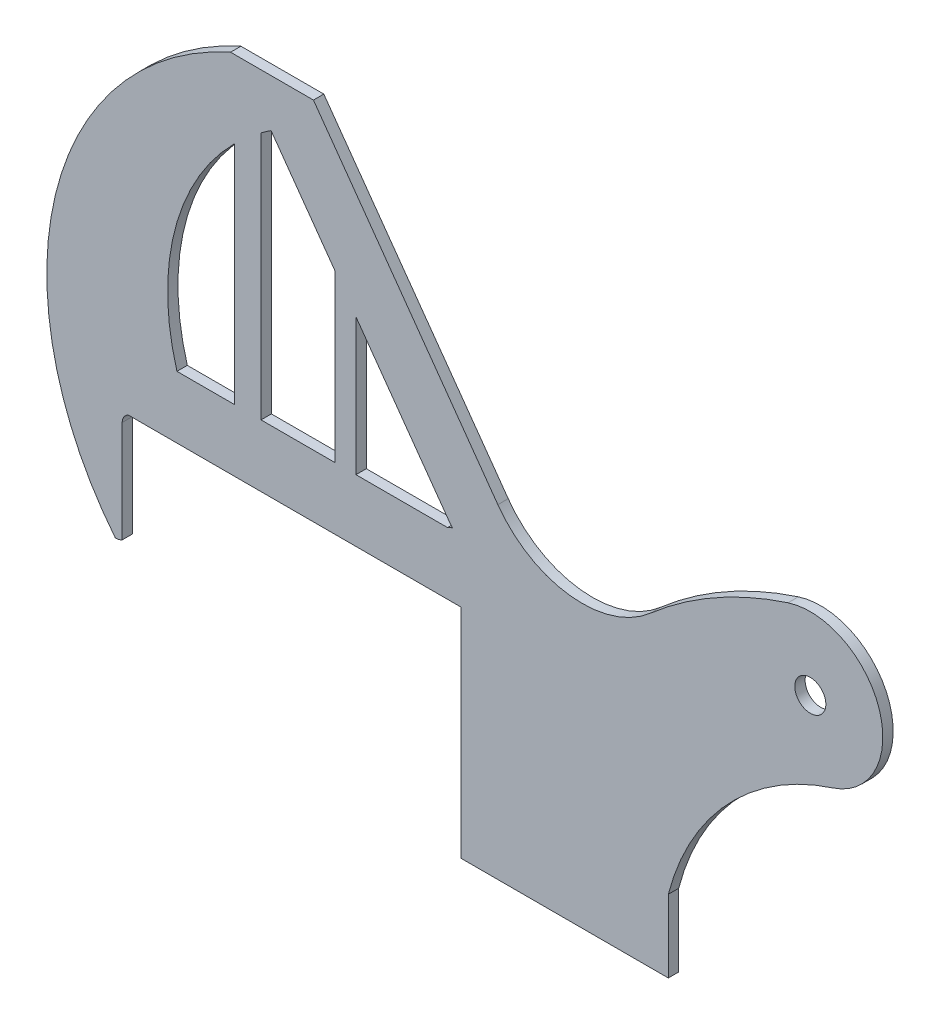
from build123d import *

# Parameters (mm, degrees)
BASE_FLANGE1_DEPTH  = 5
CUT_EXTRUDE1_DEPTH  = 10
CUT_EXTRUDE2_DEPTH  = 10
BOSS_EXTRUDE1_DEPTH = 5
CUT_EXTRUDE3_DEPTH  = 5
CUT_EXTRUDE5_DEPTH  = 5
SKETCH15_W          = 100
SKETCH15_H          = 35
BOSS_EXTRUDE2_DEPTH = 5
SKETCH16_R          = 7.5
CUT_EXTRUDE6_DEPTH  = 100


# Sheet-metal steps are written as plain solids
with BuildPart() as part:
    # Sketch1 → Base-Flange1 (new body)
    with BuildSketch(Plane.XY):
        with BuildLine():
            Line((-172.42323657, -64.083711984), (-14.82323657, -64.083711984))
            Line((-14.82323657, -64.083711984), (-14.82323657, -134.083711984))
            Line((-14.82323657, -134.083711984), (85.17676343, -134.083711984))
            ThreePointArc((85.17676343, -134.083711984), (114.024568083, -81.852692198), (164.46176985, -49.972228916))
            ThreePointArc((164.46176985, -49.972228916), (187.009648293, -5.908715918), (142.946135295, 16.639162525))
            ThreePointArc((142.946135295, 16.639162525), (107.787942262, 1.20592631), (76.450543226, -20.980798078))
            ThreePointArc((76.450543226, -20.980798078), (37.765121816, -32.96154582), (2.896719251, -12.363132081))
            Line((2.896719251, -12.363132081), (-97.103280749, 127.636867919))
            ThreePointArc((-97.103280749, 127.636867919), (-176.806189112, 48.29369713), (-172.42323657, -64.083711984))
        make_face()
    extrude(amount=-BASE_FLANGE1_DEPTH)

    # Sketch6 → Cut-Extrude1 (cut)
    with BuildSketch(Plane.XY):
        with BuildLine():
            Line((-151.988076483, -34.083711984), (-124.250121533, -34.083711984))
            Line((-124.250121533, -34.083711984), (-124.250121533, 74.916288016))
            ThreePointArc((-124.250121533, 74.916288016), (-153.103689858, 24.229516511), (-151.988076483, -34.083711984))
        make_face()
        with BuildLine():
            Line((-111.40090947, -34.083711984), (-75.598546249, -34.083711984))
            Line((-75.598546249, -34.083711984), (-75.598546249, 45.916288016))
            Line((-75.598546249, 45.916288016), (-106.558315083, 89.259964383))
            ThreePointArc((-106.558315083, 89.259964383), (-109.00197636, 87.620515753), (-111.40090947, 85.916288016))
            Line((-111.40090947, 85.916288016), (-111.40090947, -34.083711984))
        make_face()
        with BuildLine():
            Line((-65.598546249, -34.083711984), (-21.382216912, -34.083711984))
            Line((-21.382216912, -34.083711984), (-19.084071622, -33.028366909))
            ThreePointArc((-19.084071622, -33.028366909), (-20.320064907, -31.42967647), (-21.515284886, -29.800277893))
            Line((-21.515284886, -29.800277893), (-65.598546249, 31.916288016))
            Line((-65.598546249, 31.916288016), (-65.598546249, -34.083711984))
        make_face()
    extrude(amount=-CUT_EXTRUDE1_DEPTH, mode=Mode.SUBTRACT)

    # Sketch7 → Cut-Extrude2 (cut)
    with BuildSketch(Plane.XY):
        with BuildLine():
            ThreePointArc((-97.103280749, 127.636867919), (-112.063433166, 120.801319497), (-126.118657218, 112.258394975))
            Line((-126.118657218, 112.258394975), (-86.118657218, 112.258394975))
            Line((-86.118657218, 112.258394975), (-97.103280749, 127.636867919))
        make_face()
    extrude(amount=-CUT_EXTRUDE2_DEPTH, mode=Mode.SUBTRACT)

    # Sketch8 → Boss-Extrude1 (add)
    with BuildSketch(Plane.XY):
        with BuildLine():
            ThreePointArc((-126.118657218, 112.258394975), (-211.691552632, 5.764970244), (-175.42323657, -125.9475166))
            Line((-175.42323657, -125.9475166), (-175.42323657, -64.083711984))
            Line((-175.42323657, -64.083711984), (-172.42323657, -64.083711984))
            ThreePointArc((-172.42323657, -64.083711984), (-181.910795868, 32.658036849), (-126.118657218, 112.258394975))
        make_face()
    extrude(amount=-BOSS_EXTRUDE1_DEPTH)

    # Sketch9 → Cut-Extrude3 (cut)
    with BuildSketch(Plane.XY):
        with BuildLine():
            ThreePointArc((-175.42323657, -64.083711984), (-177.606536703, -65.927674892), (-178.42323657, -68.666287679))
            Line((-178.42323657, -68.666287679), (-178.42323657, -122.571183635))
            ThreePointArc((-178.42323657, -122.571183635), (-176.936364973, -124.270169842), (-175.424090186, -125.946584542))
            Line((-175.424090186, -125.946584542), (-175.42323657, -125.945602803))
            Line((-175.42323657, -125.945602803), (-175.42323657, -64.083711984))
        make_face()
        with BuildLine():
            ThreePointArc((-175.424090186, -125.946584542), (-176.936364973, -124.270169842), (-178.42323657, -122.571183635))
            Line((-178.42323657, -122.571183635), (-178.42323657, -129.395889076))
            Line((-178.42323657, -129.395889076), (-175.424090186, -125.946584542))
        make_face()
    extrude(amount=-CUT_EXTRUDE3_DEPTH, mode=Mode.SUBTRACT)


with BuildPart() as cut_extrude3_piece_1:
    # of the separate pieces the step leaves, piece 1, a body of its own (cut_extrude3_pieces)
    add(part.part.solids().sort_by_distance((-126.118657218, 112.258394975, 0))[0])

    # Sketch14 → Cut-Extrude5 (cut)
    with BuildSketch(Plane.XY):
        with BuildLine():
            ThreePointArc((-178.42323657, -117.767336057), (-181.723623091, -118.563659579), (-184.927830167, -117.441278471))
            Line((-184.927830167, -117.441278471), (-178.42323657, -122.571183635))
            Line((-178.42323657, -122.571183635), (-178.42323657, -117.767336057))
        make_face()
    extrude(amount=-CUT_EXTRUDE5_DEPTH, mode=Mode.SUBTRACT)

    # Sketch15 → Boss-Extrude2 (add)
    with BuildSketch(Plane.XY):
        with Locations((35.17676343, -151.583711984)):
            Rectangle(SKETCH15_W, SKETCH15_H)
    extrude(amount=-BOSS_EXTRUDE2_DEPTH)

    # Sketch16 → Cut-Extrude6 (cut)
    with BuildSketch(Plane.XY):
        with Locations((153.703952572, -16.666533195)):
            Circle(SKETCH16_R)
    extrude(amount=-CUT_EXTRUDE6_DEPTH, mode=Mode.SUBTRACT)


with BuildPart() as cut_extrude3_piece_2:
    # of the separate pieces the step leaves, piece 2, a body of its own (cut_extrude3_pieces)
    add(part.part.solids().sort_by_distance((-175.424090186, -125.946584542, 0))[0])


solid = Compound([cut_extrude3_piece_1.part, cut_extrude3_piece_2.part])
